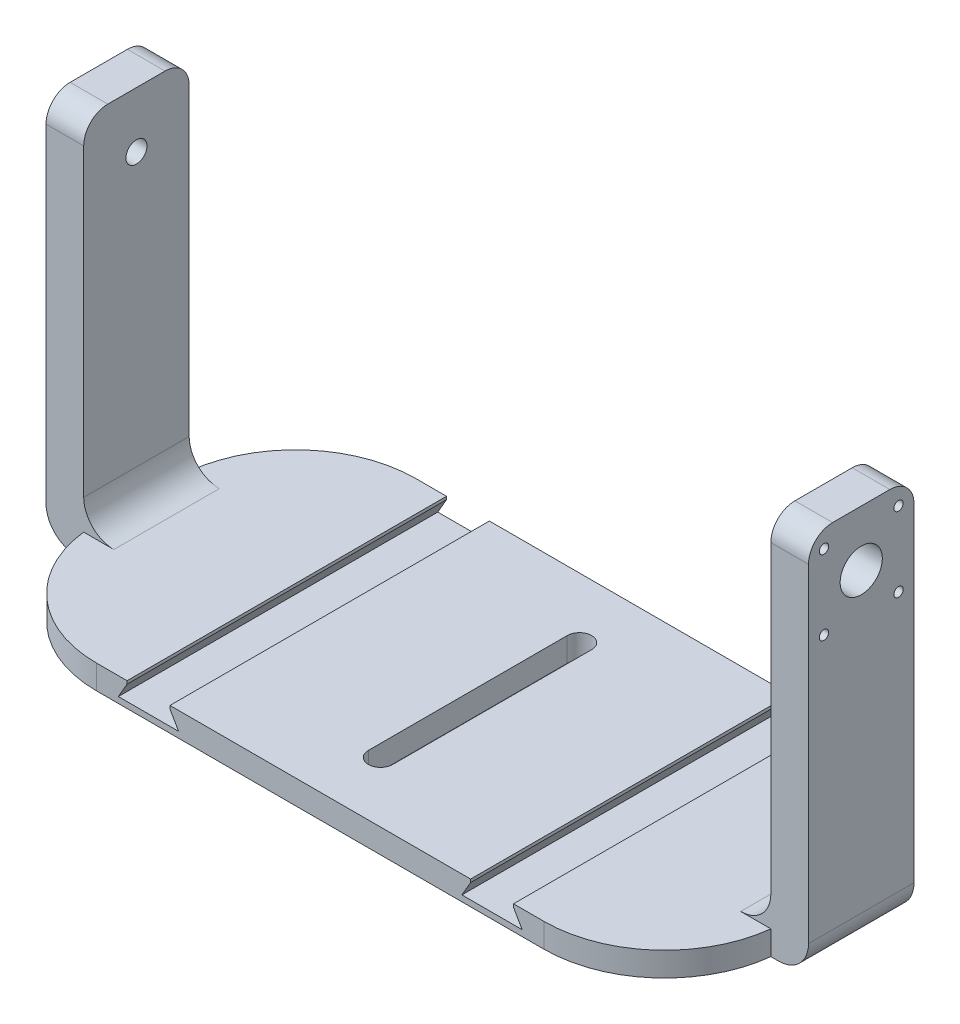
from build123d import *

# Parameters (mm, degrees)
SKETCH1_W           = 12.5
SKETCH1_H           = 127
BOSS_EXTRUDE1_DEPTH = 106
SKETCH2_W           = 12.5
SKETCH2_H           = 35.5
CUT_EXTRUDE1_DEPTH  = 200
SKETCH4_4_R         = 6
CUT_EXTRUDE3_DEPTH  = 37
SKETCH4_R           = 7
SKETCH4_R_2         = 1.55
CUT_EXTRUDE4_DEPTH  = 18.375
FILLET3_R           = 8
FILLET4_R           = 10
FILLET5_R           = 40
SKETCH5_R           = 3.5
CUT_EXTRUDE5_DEPTH  = 25
CUT_EXTRUDE6_START  = -6
SKETCH5_3_R         = 9.5
SKETCH5_3_R_2       = 3.5
CUT_EXTRUDE6_DEPTH  = 7


with BuildPart() as part:
    # Sketch1 → Boss-Extrude1 (new body)
    with BuildSketch(Plane.XY):
        Polygon((0, 8), (0, 0), (228, 0), (228, 8), (178.113248654, 8), (178.113248654, 7), (181, 2), (161, 2), (163.886751346, 7), (163.886751346, 8), (64.113248654, 8), (64.113248654, 7), (67, 2), (47, 2), (49.886751346, 7), (49.886751346, 8), align=None)
        with Locations((234.25, 63.5)):
            Rectangle(SKETCH1_W, SKETCH1_H)
        with Locations((-6.25, 63.5)):
            Rectangle(SKETCH1_W, SKETCH1_H)
    extrude(amount=-BOSS_EXTRUDE1_DEPTH)

    # Sketch2 → Cut-Extrude1 (cut)
    with BuildSketch(Plane(origin=(0, 127, 0), x_dir=(1, 0, 0), z_dir=(0, 1, 0))):
        with Locations((-6.25, 88.25)):
            Rectangle(SKETCH2_W, SKETCH2_H)
        with Locations((-6.25, 17.75)):
            Rectangle(SKETCH2_W, SKETCH2_H)
        with Locations((234.25, 88.25)):
            Rectangle(SKETCH2_W, SKETCH2_H)
        with Locations((234.25, 17.75)):
            Rectangle(SKETCH2_W, SKETCH2_H)
        with BuildLine():
            Line((109.95, 20), (109.95, 86))
            ThreePointArc((109.95, 86), (114, 90.05), (118.05, 86))
            Line((118.05, 86), (118.05, 20))
            ThreePointArc((118.05, 20), (114, 15.95), (109.95, 20))
        make_face()
    extrude(amount=-CUT_EXTRUDE1_DEPTH, mode=Mode.SUBTRACT)

    # Sketch4<4> → Cut-Extrude3 (cut)
    with BuildSketch(Plane(origin=(240.5, 0, 0), x_dir=(0, 0, -1), z_dir=(1, 0, 0))):
        with Locations((53, 108.5)):
            Circle(SKETCH4_4_R)
    extrude(amount=-CUT_EXTRUDE3_DEPTH, mode=Mode.SUBTRACT)

    # Sketch4 → Cut-Extrude4 (cut)
    with BuildSketch(Plane(origin=(240.5, 0, 0), x_dir=(0, 0, -1), z_dir=(1, 0, 0))):
        with Locations((53, 108.5)):
            Circle(SKETCH4_R)
        with Locations((40.625, 120.875)):
            Circle(SKETCH4_R_2)
        with Locations((40.625, 96.125)):
            Circle(SKETCH4_R_2)
        with Locations((65.375, 96.125)):
            Circle(SKETCH4_R_2)
        with Locations((65.375, 120.875)):
            Circle(SKETCH4_R_2)
    extrude(amount=-CUT_EXTRUDE4_DEPTH, mode=Mode.SUBTRACT)

    # Fillet3
    fillet3_edges = [part.edges().sort_by_distance(p)[0] for p in [
        (-6.25, 127, -35.5),
        (234.25, 127, -70.5),
        (234.25, 127, -35.5),
        (-6.25, 127, -70.5),
    ]]
    fillet(fillet3_edges, radius=FILLET3_R)

    # Fillet4
    fillet4_edges = [part.edges().sort_by_distance(p)[0] for p in [
        (228, 8, -53),
        (240.5, 0, -53),
        (0, 8, -53),
        (-12.5, 0, -53),
    ]]
    fillet(fillet4_edges, radius=FILLET4_R)

    # Fillet5
    # the kernel refuses this fillet: 40 mm, written as the material it takes off along each edge
    with BuildSketch(Plane(origin=(228, 107.36517247, -106), x_dir=(-1, 0, 0), z_dir=(0, -1, 0))) as fillet5_piece_1:
        with BuildLine():
            CenterArc((39.746068988, -40), FILLET5_R, 90, 83.540550223)
            Line((0, -35.5), (-0.79492138, -35.41))
            ThreePointArc((-0.79492138, -35.41), (-0.8, -17.75), (-0.8, 0))
            Line((-0.8, 0), (0, 0.8))
            Line((0, 0.8), (39.746068988, 0.8))
            Line((39.746068988, 0.8), (39.746068988, 0))
        make_face()
    extrude(amount=206.73034494, mode=Mode.SUBTRACT)
    with BuildSketch(Plane(origin=(0, 107.36517247, -106), x_dir=(0, 0, 1), z_dir=(0, -1, 0))) as fillet5_piece_2:
        with BuildLine():
            CenterArc((40, -39.746068988), FILLET5_R, 96.459449777, 83.540550223)
            Line((0, -39.746068988), (-0.8, -39.746068988))
            Line((-0.8, -39.746068988), (-0.8, 0))
            Line((-0.8, 0), (0, 0.8))
            ThreePointArc((0, 0.8), (17.75, 0.8), (35.41, 0.79492138))
            Line((35.41, 0.79492138), (35.5, 0))
        make_face()
    extrude(amount=206.73034494, mode=Mode.SUBTRACT)
    with BuildSketch(Plane(origin=(0, 107.36517247, 0), x_dir=(0, 0, -1), z_dir=(0, -1, 0))) as fillet5_piece_3:
        with BuildLine():
            CenterArc((40, 39.746068988), FILLET5_R, 180, 83.540550223)
            Line((0, 39.746068988), (-0.8, 39.746068988))
            Line((-0.8, 39.746068988), (-0.8, 0))
            Line((-0.8, 0), (0, -0.8))
            ThreePointArc((0, -0.8), (17.75, -0.8), (35.41, -0.79492138))
            Line((35.41, -0.79492138), (35.5, 0))
        make_face()
    extrude(amount=206.73034494, mode=Mode.SUBTRACT)
    with BuildSketch(Plane(origin=(228, 107.36517247, 0), x_dir=(-1, 0, 0), z_dir=(0, -1, 0))) as fillet5_piece_4:
        with BuildLine():
            CenterArc((39.746068988, 40), FILLET5_R, 186.459449777, 83.540550223)
            Line((0, 35.5), (-0.79492138, 35.41))
            ThreePointArc((-0.79492138, 35.41), (-0.8, 17.75), (-0.8, 0))
            Line((-0.8, 0), (0, -0.8))
            Line((0, -0.8), (39.746068988, -0.8))
            Line((39.746068988, -0.8), (39.746068988, 0))
        make_face()
    extrude(amount=206.73034494, mode=Mode.SUBTRACT)

    # Sketch5 → Cut-Extrude5 (cut)
    with BuildSketch(Plane(origin=(0, 0, 0), x_dir=(0, 0, -1), z_dir=(1, 0, 0))):
        with Locations((53, 108.5)):
            Circle(SKETCH5_R)
    extrude(amount=-CUT_EXTRUDE5_DEPTH, mode=Mode.SUBTRACT)

    # Sketch5<3> → Cut-Extrude6 (cut)
    with BuildSketch(Plane(origin=(0, 0, 0), x_dir=(0, 0, -1), z_dir=(1, 0, 0)).offset(CUT_EXTRUDE6_START)):
        with Locations((53, 108.5)):
            Circle(SKETCH5_3_R)
        with Locations((53, 108.5)):
            Circle(SKETCH5_3_R_2, mode=Mode.SUBTRACT)
    extrude(amount=-CUT_EXTRUDE6_DEPTH, mode=Mode.SUBTRACT)


solid = part.part
